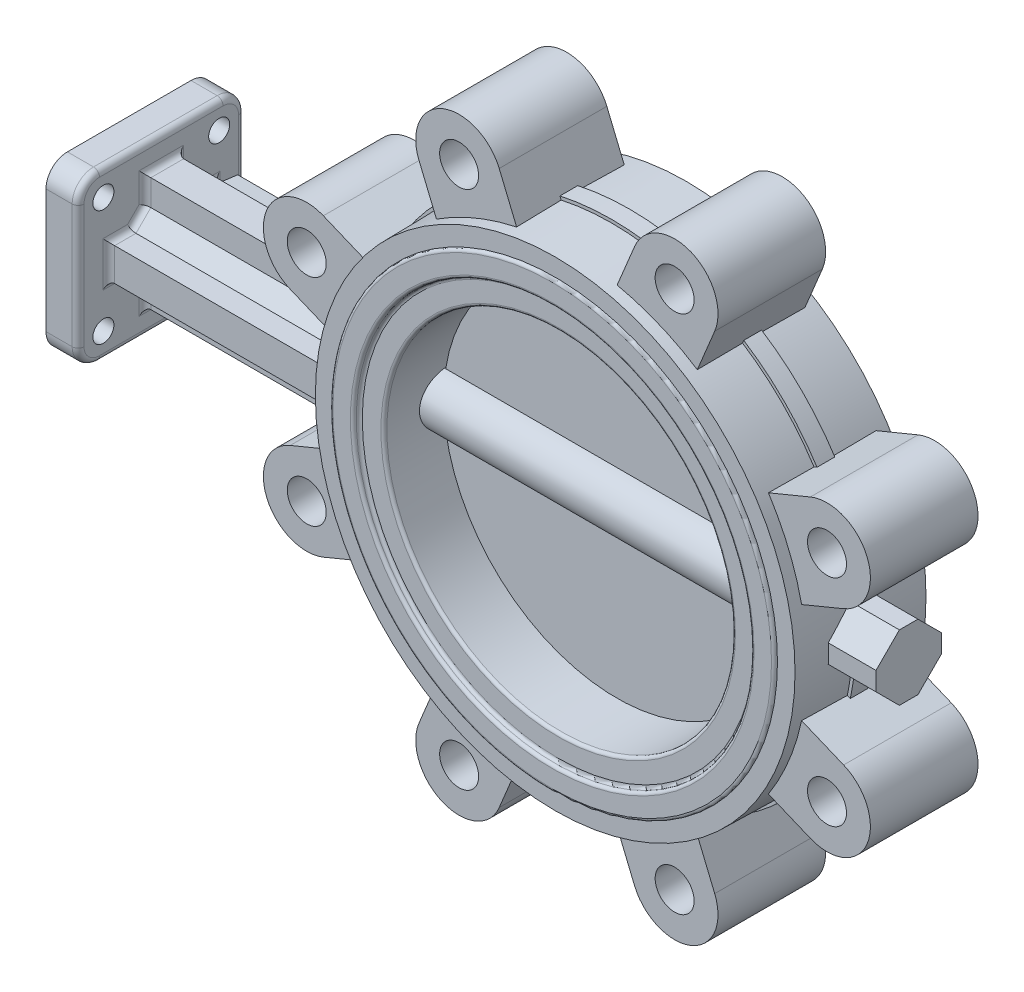
from build123d import *

# Parameters (mm, degrees)
SKETCH1_R                     = 103.000048
BOSS_EXTRUDE1_DEPTH           = 27.9908
BOSS_EXTRUDE1_TAPER           = 1
BOSS_EXTRUDE1_OTHER_WAY_DEPTH = 27.9908
BOSS_EXTRUDE1_OTHER_WAY_TAPER = 1
SKETCH2_R                     = 95
BOSS_EXTRUDE2_DEPTH           = 1.27
BOSS_EXTRUDE3_START           = 1.27
SKETCH3_R                     = 95
BOSS_EXTRUDE3_DEPTH           = 1.27
SKETCH5_R                     = 85
CUT_EXTRUDE2_DEPTH            = 2.54
CUT_EXTRUDE1_START            = -2.54
SKETCH4_R                     = 85
CUT_EXTRUDE1_DEPTH            = 2.54
CUT_EXTRUDE3_DEPTH            = 157.051143398
CUT_EXTRUDE3_DEPTH_BACK       = 157.051143398
SKETCH6_R                     = 74.5
SKETCH7_W                     = 6.35
SKETCH7_H                     = 7.62
BOSS_EXTRUDE4_DEPTH           = 18.796
BOSS_EXTRUDE4_DEPTH_BACK      = 10
SKETCH8_W                     = 27.94
SKETCH8_H                     = 27.94
CHAMFER1_SIZE                 = 10
BOSS_EXTRUDE5_DEPTH           = 92.0663894
BOSS_EXTRUDE5_DEPTH_BACK      = 12.7
SKETCH11_W                    = 71.12
SKETCH11_H                    = 71.12
BOSS_EXTRUDE7_DEPTH           = 13.716
CHAMFER2_SIZE                 = 6.35
FILLET1_R                     = 9.144
SKETCH12_W                    = 57.15
SKETCH12_H                    = 31.75
BOSS_EXTRUDE8_DEPTH           = 18.669
BOSS_EXTRUDE8_TAPER           = 4
FILLET2_R                     = 1.27
SKETCH14_R                    = 11.5062
CUT_EXTRUDE5_DEPTH            = 7.62
M8_CLEARANCE_HOLE1_D          = 9
M8_CLEARANCE_HOLE1_DEPTH      = 13.716
SKETCH18_R                    = 11.5
BOSS_EXTRUDE9_DEPTH           = 211.328
SKETCH19_R                    = 9.0043
BOSS_EXTRUDE10_DEPTH          = 6.62
BOSS_EXTRUDE11_DEPTH          = 19.5
CHAMFER3_SIZE                 = 1.5
SKETCH21_R                    = 74
BOSS_EXTRUDE12_DEPTH          = 1.665
BOSS_EXTRUDE13_DEPTH          = 23
CIRPATTERN1_COUNT             = 8
F_3_4_10_TAPPED_HOLE1_D       = 16.66748
FILLET3_R                     = 2.54


# Some blends are built 0.0001 mm under size
with BuildPart() as part:
    # Sketch1 → Boss-Extrude1 (new body)
    with BuildSketch(Plane.XY):
        Circle(SKETCH1_R)
    extrude(amount=BOSS_EXTRUDE1_DEPTH, taper=BOSS_EXTRUDE1_TAPER)

    # Sketch1 → Boss-Extrude1 other way (add)
    with BuildSketch(Plane.XY):
        Circle(SKETCH1_R)
    extrude(amount=-BOSS_EXTRUDE1_OTHER_WAY_DEPTH, taper=BOSS_EXTRUDE1_OTHER_WAY_TAPER)

    # Sketch2 → Boss-Extrude2 (add)
    with BuildSketch(Plane.XY.offset(27.9908)):
        Circle(SKETCH2_R)
    extrude(amount=BOSS_EXTRUDE2_DEPTH)

    # Sketch3 → Boss-Extrude3 (add)
    with BuildSketch(Plane(origin=(0, 0, -27.9908), x_dir=(-1, 0, 0), z_dir=(0, 0, -1)).offset(BOSS_EXTRUDE3_START)):
        with Locations(Location((0, 0, 0), (0, 0, 180))):
            Circle(SKETCH3_R)
    extrude(amount=-BOSS_EXTRUDE3_DEPTH)

    # Sketch5 → Cut-Extrude2 (cut)
    with BuildSketch(Plane.XY.offset(29.2608)):
        Circle(SKETCH5_R)
    extrude(amount=-CUT_EXTRUDE2_DEPTH, mode=Mode.SUBTRACT)

    # Sketch4 → Cut-Extrude1 (cut)
    with BuildSketch(Plane(origin=(0, 0, -29.2608), x_dir=(-1, 0, 0), z_dir=(0, 0, -1)).offset(CUT_EXTRUDE1_START)):
        with Locations(Location((0, 0, 0), (0, 0, 180))):
            Circle(SKETCH4_R)
    extrude(amount=CUT_EXTRUDE1_DEPTH, mode=Mode.SUBTRACT)

    # Sketch6 → Cut-Extrude3 (cut, two sides: drawn at the far end of the back side and taken through both)
    with BuildSketch(Plane.XY.offset(26.7208).offset(-CUT_EXTRUDE3_DEPTH_BACK)):
        Circle(SKETCH6_R)
    extrude(amount=CUT_EXTRUDE3_DEPTH + CUT_EXTRUDE3_DEPTH_BACK, mode=Mode.SUBTRACT)

    # Sketch7 → Revolve1 (revolve)
    with BuildSketch(Plane(origin=(0, 0, 0), x_dir=(1, 0, 0), z_dir=(0, 1, 0)), mode=Mode.PRIVATE) as revolve1_sk:
        with Locations((-101.114466769, 0)):
            Rectangle(SKETCH7_W, SKETCH7_H)
    revolve(revolve1_sk.sketch.rotate(Axis((0, 0, 0), (0, 0, -1)), 180), axis=Axis((0, 0, 0), (0, 0, -1)))

    # Sketch8 → Boss-Extrude4 (add, two sides: drawn at the far end of the back side and taken through both)
    with BuildSketch(Plane(origin=(104.289466769, 0, 0), x_dir=(0, 0, -1), z_dir=(1, 0, 0)).offset(-BOSS_EXTRUDE4_DEPTH_BACK)):
        Rectangle(SKETCH8_W, SKETCH8_H)
    extrude(amount=BOSS_EXTRUDE4_DEPTH + BOSS_EXTRUDE4_DEPTH_BACK)

    # Chamfer1
    chamfer1_edges = [part.edges().sort_by_distance(p)[0] for p in [
        (112.443803833, 13.97, -13.97),
        (112.443803833, -13.97, -13.97),
        (112.443803833, -13.97, 13.97),
        (112.443803833, 13.97, 13.97),
    ]]
    chamfer(chamfer1_edges, length=CHAMFER1_SIZE)

    # Sketch9 → Boss-Extrude5 (add, two sides: drawn at the far end of the back side and taken through both)
    with BuildSketch(Plane.ZY.offset(104.289466769).offset(-BOSS_EXTRUDE5_DEPTH_BACK)):
        Polygon((-22.479, 7), (-7, 7), (-7, 24.4094), (7, 24.4094), (7, 7), (22.479, 7), (22.479, -7), (7, -7), (7, -24.4094), (-7, -24.4094), (-7, -7), (-22.479, -7), align=None)
    extrude(amount=BOSS_EXTRUDE5_DEPTH + BOSS_EXTRUDE5_DEPTH_BACK)

    # Sketch11 → Boss-Extrude7 (add)
    with BuildSketch(Plane.ZY.offset(196.355856169)):
        Rectangle(SKETCH11_W, SKETCH11_H)
    extrude(amount=BOSS_EXTRUDE7_DEPTH)

    # Chamfer2
    chamfer2_edges = [part.edges().sort_by_distance(p)[0] for p in [
        (-149.497647983, 7, 7),
        (-149.497647983, -7, 7),
        (-149.497647983, -7, -7),
        (-149.497647983, 7, -7),
    ]]
    chamfer(chamfer2_edges, length=CHAMFER2_SIZE)

    # Fillet1
    fillet1_edges = [part.edges().sort_by_distance(p)[0] for p in [
        (-203.213856169, 35.56, -35.56),
        (-203.213856169, -35.56, -35.56),
        (-203.213856169, -35.56, 35.56),
        (-203.213856169, 35.56, 35.56),
    ]]
    fillet(fillet1_edges, radius=FILLET1_R)

    # Sketch12 → Boss-Extrude8 (add)
    with BuildSketch(Plane(origin=(0, 0, -3.81), x_dir=(-1, 0, 0), z_dir=(0, 0, -1))):
        with Locations((158.890856169, 0)):
            Rectangle(SKETCH12_W, SKETCH12_H)
    extrude(amount=BOSS_EXTRUDE8_DEPTH, taper=BOSS_EXTRUDE8_TAPER)

    # Fillet2
    fillet2_edges = [part.edges().sort_by_distance(p)[0] for p in [
        (-95, 0, 29.2608),
        (-95, 0, -29.2608),
        (-85, 0, 26.7208),
        (-85, 0, 29.2608),
        (-85, 0, -26.7208),
        (-85, 0, -29.2608),
        (-74.5, 0, 26.7208),
        (-74.5, 0, -26.7208),
    ]]
    fillet(fillet2_edges, radius=FILLET2_R - 0.0001)  # a hair under: the kernel refuses the full size

    # Sketch14 → Cut-Extrude5 (cut)
    with BuildSketch(Plane.ZY.offset(210.071856169)):
        Circle(SKETCH14_R)
    extrude(amount=-CUT_EXTRUDE5_DEPTH, mode=Mode.SUBTRACT)

    # M8 Clearance Hole1
    with Locations(Plane.ZY.offset(210.071856169)):
        with Locations((-24.748737342, 24.748737342), (24.748737342, 24.748737342), (24.748737342, -24.748737342), (-24.748737342, -24.748737342)):
            Hole(M8_CLEARANCE_HOLE1_D / 2, depth=M8_CLEARANCE_HOLE1_DEPTH)

    # Sketch18 → Boss-Extrude9 (add)
    with BuildSketch(Plane(origin=(123.085466769, 0, 0), x_dir=(0, 0, -1), z_dir=(1, 0, 0))):
        Circle(SKETCH18_R)
    extrude(amount=-BOSS_EXTRUDE9_DEPTH)

    # Sketch19 → Boss-Extrude10 (add)
    with BuildSketch(Plane.ZY.offset(202.451856169)):
        with Locations(Location((0, 0, 0), (0, 0, 180))):
            Circle(SKETCH19_R)
    extrude(amount=BOSS_EXTRUDE10_DEPTH)

    # Sketch20 → Boss-Extrude11 (add)
    with BuildSketch(Plane.ZY.offset(209.071856169)):
        Polygon((0, 9.878281733), (-9.878281733, 0), (0, -9.878281733), (9.878281733, 0), align=None)
    extrude(amount=BOSS_EXTRUDE11_DEPTH)

    # Chamfer3
    # the kernel refuses this chamfer: 1.5 mm, written as the material it takes off along each edge
    with BuildSketch(Plane(origin=(-209.071856169, 0, 9.878281733), x_dir=(0, 0.7262819568766866, -0.6873969152646604), z_dir=(-1, 0, 0)), Plane(origin=(-209.071856169, 9.878281733, 0), x_dir=(0, -0.687396915264658, -0.726281956876689), z_dir=(-1, 0, 0)), Plane(origin=(-209.071856169, 0, -9.878281733), x_dir=(0, -0.7262819568766864, 0.6873969152646605), z_dir=(-1, 0, 0))) as chamfer3_piece_1:
        Polygon((CHAMFER3_SIZE * 0.999621916911, CHAMFER3_SIZE * 0.0274958766106), (-CHAMFER3_SIZE * 0.0274958766106, CHAMFER3_SIZE * 0.999621916911), (0, 0), align=None)
    extrude(amount=23.357524482, mode=Mode.SUBTRACT)
    with BuildSketch(Plane(origin=(-209.071856169, -9.878281733, 0), x_dir=(0, 0.687396915264658, -0.7262819568766888), z_dir=(-1, 0, 0))) as chamfer3_piece_2:
        Polygon((CHAMFER3_SIZE * 0.999621916911, -CHAMFER3_SIZE * 0.0274958766106), (-CHAMFER3_SIZE * 0.0274958766106, -CHAMFER3_SIZE * 0.999621916911), (0, 0), align=None)
    extrude(amount=23.357524482, mode=Mode.SUBTRACT)

    # Sketch21 → Boss-Extrude12 (add, symmetric)
    with BuildSketch(Plane.XY):
        Circle(SKETCH21_R)
    extrude(amount=BOSS_EXTRUDE12_DEPTH, both=True)

    # Sketch22 → Boss-Extrude13 (add, symmetric)
    with BuildSketch(Plane.XY):
        with BuildLine():
            Line((-104.088750913, 63.184688496), (-86.050380247, 55.712950724))
            ThreePointArc((-86.050380247, 55.712950724), (-94.708245995, 39.22943996), (-100.241812653, 21.45180214))
            Line((-100.241812653, 21.45180214), (-118.280183319, 28.923539913))
            ThreePointArc((-118.280183319, 28.923539913), (-128.315041408, 53.149830408), (-104.088750913, 63.184688496))
        make_face()
    boss_extrude13 = extrude(amount=BOSS_EXTRUDE13_DEPTH, both=True)

    # CirPattern1: Boss-Extrude13 ×8 about axis
    cirpattern1_axis = Axis((0, 0, 0), (0, 0, 1))
    for i in range(1, CIRPATTERN1_COUNT):
        add(boss_extrude13.rotate(cirpattern1_axis, i * 360 / CIRPATTERN1_COUNT))

    # 3/4-10 Tapped Hole1 (through all)
    with Locations(Plane.XY.offset(23)):
        with Locations((-46.054114205, 111.184467116), (-111.184467116, 46.054114205), (111.184467116, 46.054114205), (46.054114205, 111.184467116), (111.184467116, -46.054114205), (46.054114205, -111.184467116), (-46.054114205, -111.184467116), (-111.184467116, -46.054114205)):
            Hole(F_3_4_10_TAPPED_HOLE1_D / 2)

    # Fillet3
    fillet3_edges = [part.edges().sort_by_distance(p)[0] for p in [
        (-196.355856169, 0, 22.479),
        (-196.355856169, 7, 17.9145),
        (-196.355856169, 24.4094, 0),
        (-196.355856169, 18.8797, -7),
        (-196.355856169, 0, -22.479),
        (-196.355856169, -7, -17.9145),
        (-196.355856169, -24.4094, 0),
        (-196.355856169, -18.8797, 7),
        (-196.355856169, -7, 17.9145),
        (-196.355856169, 18.8797, 7),
        (-196.355856169, 7, -17.9145),
        (-196.355856169, -18.8797, -7),
        (-196.355856169, 10.175, -10.175),
        (-196.355856169, -10.175, -10.175),
        (-196.355856169, -10.175, 10.175),
        (-196.355856169, 10.175, 10.175),
        (-196.355856169, 0, -35.56),
        (-196.355856169, 35.56, 0),
        (-196.355856169, 0, 35.56),
        (-196.355856169, -35.56, 0),
        (-196.355856169, -32.881784407, 32.881784407),
        (-196.355856169, -32.881784407, -32.881784407),
        (-196.355856169, 32.881784407, 32.881784407),
        (-196.355856169, 32.881784407, -32.881784407),
    ]]
    fillet(fillet3_edges, radius=FILLET3_R)


solid = part.part
